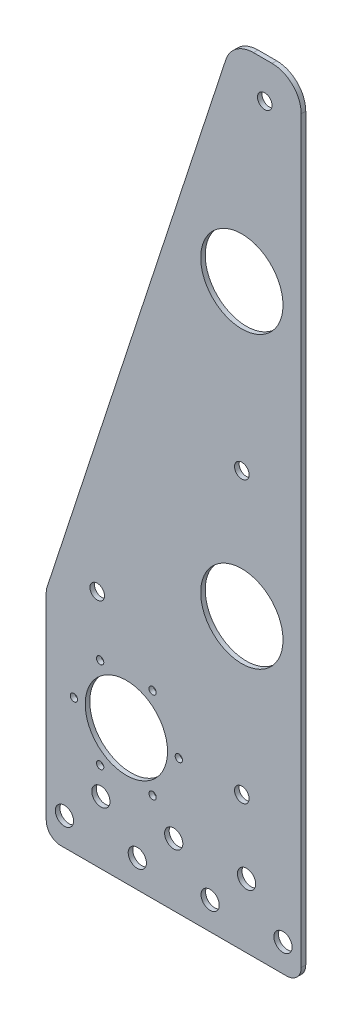
from build123d import *

# Parameters (mm, degrees)
SKETCH1_R           = 14.351
SKETCH1_R_2         = 2.54
SKETCH1_R_3         = 3.175
SKETCH1_R_4         = 1.27
BOSS_EXTRUDE1_DEPTH = 1.5875
SKETCH2_R           = 2.54
BOSS_EXTRUDE2_DEPTH = 1.5875
SKETCH3_R           = 2.54
CUT_EXTRUDE1_DEPTH  = 288.162032059


with BuildPart() as part:
    # Sketch1 → Boss-Extrude1 (new body)
    with BuildSketch(Plane.XY):
        with BuildLine():
            Line((88.9, 212.09), (88.9, 5.08))
            ThreePointArc((88.9, 5.08), (87.412102448, 1.487897552), (83.82, 0))
            Line((83.82, 0), (5.08, 0))
            ThreePointArc((5.08, 0), (1.487897552, 1.487897552), (0, 5.08))
            Line((0, 5.08), (0, 73.969993162))
            ThreePointArc((0, 73.969993162), (0.063384098, 74.769971217), (0.25195468, 75.549986324))
            Line((0.25195468, 75.549986324), (45.969223296, 215.249986324))
            ThreePointArc((45.969223296, 215.249986324), (49.662087504, 220.315906061), (55.625313935, 222.25))
            Line((55.625313935, 222.25), (78.74, 222.25))
            ThreePointArc((78.74, 222.25), (85.924204897, 219.274204897), (88.9, 212.09))
        make_face()
        with Locations((68.199, 201.93)):
            Circle(SKETCH1_R, mode=Mode.SUBTRACT)
        with Locations((68.199, 100.838)):
            Circle(SKETCH1_R, mode=Mode.SUBTRACT)
        with Locations((68.199, 144.78)):
            Circle(SKETCH1_R_2, mode=Mode.SUBTRACT)
        with Locations((68.199, 46.99)):
            Circle(SKETCH1_R_2, mode=Mode.SUBTRACT)
        with Locations((27.94, 46.99)):
            Circle(SKETCH1_R, mode=Mode.SUBTRACT)
        with Locations((6.35, 9.652)):
            Circle(SKETCH1_R_3, mode=Mode.SUBTRACT)
        with Locations((31.75, 9.652)):
            Circle(SKETCH1_R_3, mode=Mode.SUBTRACT)
        with Locations((57.15, 9.652)):
            Circle(SKETCH1_R_3, mode=Mode.SUBTRACT)
        with Locations((82.55, 9.652)):
            Circle(SKETCH1_R_3, mode=Mode.SUBTRACT)
        with Locations((69.85, 22.352)):
            Circle(SKETCH1_R_3, mode=Mode.SUBTRACT)
        with Locations((44.45, 21.844)):
            Circle(SKETCH1_R_3, mode=Mode.SUBTRACT)
        with Locations((19.05, 21.844)):
            Circle(SKETCH1_R_3, mode=Mode.SUBTRACT)
        with Locations((46.228, 46.99)):
            Circle(SKETCH1_R_4, mode=Mode.SUBTRACT)
        with Locations((37.084, 31.152127416)):
            Circle(SKETCH1_R_4, mode=Mode.SUBTRACT)
        with Locations((18.796, 31.152127416)):
            Circle(SKETCH1_R_4, mode=Mode.SUBTRACT)
        with Locations((9.652, 46.99)):
            Circle(SKETCH1_R_4, mode=Mode.SUBTRACT)
        with Locations((18.796, 62.827872584)):
            Circle(SKETCH1_R_4, mode=Mode.SUBTRACT)
        with Locations((37.084, 62.827872584)):
            Circle(SKETCH1_R_4, mode=Mode.SUBTRACT)
    extrude(amount=BOSS_EXTRUDE1_DEPTH)

    # Sketch2 → Boss-Extrude2 (add)
    with BuildSketch(Plane.XY.offset(1.5875)):
        with BuildLine():
            Line((45.969223296, 215.249986324), (62.593684611, 266.049986324))
            ThreePointArc((62.593684611, 266.049986324), (66.286548819, 271.115906061), (72.24977525, 273.05))
            Line((72.24977525, 273.05), (78.74, 273.05))
            ThreePointArc((78.74, 273.05), (85.924204897, 270.074204897), (88.9, 262.89))
            Line((88.9, 262.89), (88.9, 212.09))
            Line((88.9, 212.09), (78.74, 222.25))
            Line((78.74, 222.25), (55.625313935, 222.25))
            Line((55.625313935, 222.25), (45.969223296, 215.249986324))
        make_face()
        with Locations((76.2, 260.35)):
            Circle(SKETCH2_R, mode=Mode.SUBTRACT)
    extrude(amount=-BOSS_EXTRUDE2_DEPTH)

    # Sketch3 → Cut-Extrude1 (cut, through all)
    with BuildSketch(Plane.XY.offset(1.5875)):
        with Locations((17.78, 83.058)):
            Circle(SKETCH3_R)
    extrude(amount=-CUT_EXTRUDE1_DEPTH, mode=Mode.SUBTRACT)


solid = part.part
